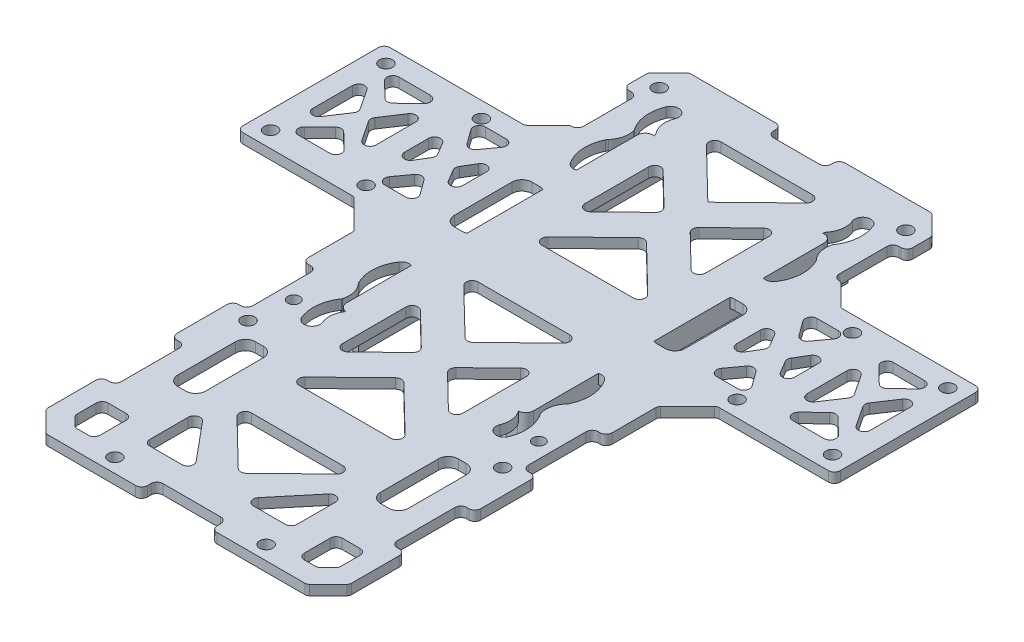
from build123d import *

# Parameters (mm, degrees)
Y_KSEKLIK_EKSTR_ZYON1_DEPTH = 2.5
IZIM3_R                     = 1.65
KES_EKSTR_ZYON1_DEPTH       = 173.688537138
IZIM4_W                     = 5
IZIM4_H                     = 77
Y_KSEKLIK_EKSTR_ZYON2_DEPTH = 2.7
IZIM5_W                     = 9
IZIM5_H                     = 2.5
Y_KSEKLIK_EKSTR_ZYON3_DEPTH = 77
Y_KSEKLIK_EKSTR_ZYON4_DEPTH = 2.5
RADYUS1_R                   = 2
Y_KSEKLIK_EKSTR_ZYON5_DEPTH = 2.5
IZIM8_R                     = 1.5
KES_EKSTR_ZYON2_DEPTH       = 173.748721728


with BuildPart() as part:
    # Çizim1 → Yükseklik-Ekstrüzyon1 (new body)
    with BuildSketch(Plane(origin=(0, 0, 0), x_dir=(1, 0, 0), z_dir=(0, 1, 0))):
        with BuildLine():
            Line((5.75, 152), (-5.75, 152))
            ThreePointArc((-5.75, 152), (-6.810660172, 152.439339828), (-7.25, 153.5))
            Line((-7.25, 153.5), (-7.25, 154))
            ThreePointArc((-7.25, 154), (-7.689339828, 155.060660172), (-8.75, 155.5))
            Line((-8.75, 155.5), (-30.05, 155.5))
            ThreePointArc((-30.05, 155.5), (-30.497739616, 155.410939053), (-30.877314934, 155.157314934))
            Line((-30.877314934, 155.157314934), (-35.296732316, 150.737897552))
            ThreePointArc((-35.296732316, 150.737897552), (-35.550356435, 150.358322233), (-35.639417382, 149.910582618))
            Line((-35.639417382, 149.910582618), (-35.639417382, 145.610582618))
            ThreePointArc((-35.639417382, 145.610582618), (-35.200077554, 144.549922446), (-34.139417382, 144.110582618))
            Line((-34.139417382, 144.110582618), (-33.639417382, 144.110582618))
            ThreePointArc((-33.639417382, 144.110582618), (-32.578757211, 143.671242789), (-32.139417382, 142.610582618))
            Line((-32.139417382, 142.610582618), (-32.139417382, 130.610582618))
            ThreePointArc((-32.139417382, 130.610582618), (-32.578757211, 129.549922446), (-33.639417382, 129.110582618))
            ThreePointArc((-33.639417382, 129.110582618), (-34.060369158, 129.026850103), (-34.417234842, 128.788400077))
            Line((-34.417234842, 128.788400077), (-39.437692988, 123.76794193))
            ThreePointArc((-39.437692988, 123.76794193), (-39.794558672, 123.529491904), (-40.215510447, 123.44575939))
            Line((-40.215510447, 123.44575939), (-73.565510447, 123.44575939))
            ThreePointArc((-73.565510447, 123.44575939), (-74.626170619, 123.006419562), (-75.065510447, 121.94575939))
            Line((-75.065510447, 121.94575939), (-75.065510447, 87.94575939))
            ThreePointArc((-75.065510447, 87.94575939), (-74.626170619, 86.885099218), (-73.565510447, 86.44575939))
            Line((-73.565510447, 86.44575939), (-46.115510447, 86.44575939))
            ThreePointArc((-46.115510447, 86.44575939), (-45.667770832, 86.356698443), (-45.288195513, 86.103074324))
            Line((-45.288195513, 86.103074324), (-38.499970414, 79.314849224))
            ThreePointArc((-38.499970414, 79.314849224), (-38.246346295, 78.935273906), (-38.157285348, 78.48753429))
            Line((-38.157285348, 78.48753429), (-38.157285348, 67.48753429))
            ThreePointArc((-38.157285348, 67.48753429), (-37.71794552, 66.426874119), (-36.657285348, 65.98753429))
            Line((-36.657285348, 65.98753429), (-36.157285348, 65.98753429))
            ThreePointArc((-36.157285348, 65.98753429), (-35.096625176, 65.548194462), (-34.657285348, 64.48753429))
            Line((-34.657285348, 64.48753429), (-34.657285348, 49.98753429))
            ThreePointArc((-34.657285348, 49.98753429), (-35.096625176, 48.926874119), (-36.157285348, 48.48753429))
            Line((-36.157285348, 48.48753429), (-36.657285348, 48.48753429))
            ThreePointArc((-36.657285348, 48.48753429), (-37.71794552, 48.048194462), (-38.157285348, 46.98753429))
            Line((-38.157285348, 46.98753429), (-38.157285348, 34.48753429))
            ThreePointArc((-38.157285348, 34.48753429), (-37.71794552, 33.426874119), (-36.657285348, 32.98753429))
            Line((-36.657285348, 32.98753429), (-36.157285348, 32.98753429))
            ThreePointArc((-36.157285348, 32.98753429), (-35.096625176, 32.548194462), (-34.657285348, 31.48753429))
            Line((-34.657285348, 31.48753429), (-34.657285348, 16.98753429))
            ThreePointArc((-34.657285348, 16.98753429), (-35.096625176, 15.926874119), (-36.157285348, 15.48753429))
            Line((-36.157285348, 15.48753429), (-36.657285348, 15.48753429))
            ThreePointArc((-36.657285348, 15.48753429), (-37.71794552, 15.048194462), (-38.157285348, 13.98753429))
            Line((-38.157285348, 13.98753429), (-38.157285348, 1.98753429))
            ThreePointArc((-38.157285348, 1.98753429), (-38.073552834, 1.566582515), (-37.835102807, 1.209716831))
            Line((-37.835102807, 1.209716831), (-33.097487373, -3.527898603))
            ThreePointArc((-33.097487373, -3.527898603), (-32.74062169, -3.766348629), (-32.319669914, -3.850081144))
            Line((-32.319669914, -3.850081144), (-10.25, -3.850081144))
            ThreePointArc((-10.25, -3.850081144), (-9.189339828, -3.410741315), (-8.75, -2.350081144))
            Line((-8.75, -2.350081144), (-8.75, -1.5))
            ThreePointArc((-8.75, -1.5), (-8.310660172, -0.439339828), (-7.25, 0))
            Line((-7.25, 0), (7.25, 0))
            ThreePointArc((7.25, 0), (8.310660172, -0.439339828), (8.75, -1.5))
            Line((8.75, -1.5), (8.75, -2.350081144))
            ThreePointArc((8.75, -2.350081144), (9.189339828, -3.410741315), (10.25, -3.850081144))
            Line((10.25, -3.850081144), (32.319669914, -3.850081144))
            ThreePointArc((32.319669914, -3.850081144), (32.74062169, -3.766348629), (33.097487373, -3.527898603))
            Line((33.097487373, -3.527898603), (37.835102807, 1.209716831))
            ThreePointArc((37.835102807, 1.209716831), (38.073552834, 1.566582515), (38.157285348, 1.98753429))
            Line((38.157285348, 1.98753429), (38.157285348, 13.98753429))
            ThreePointArc((38.157285348, 13.98753429), (37.71794552, 15.048194462), (36.657285348, 15.48753429))
            Line((36.657285348, 15.48753429), (36.157285348, 15.48753429))
            ThreePointArc((36.157285348, 15.48753429), (35.096625176, 15.926874119), (34.657285348, 16.98753429))
            Line((34.657285348, 16.98753429), (34.657285348, 31.48753429))
            ThreePointArc((34.657285348, 31.48753429), (35.096625176, 32.548194462), (36.157285348, 32.98753429))
            Line((36.157285348, 32.98753429), (36.657285348, 32.98753429))
            ThreePointArc((36.657285348, 32.98753429), (37.71794552, 33.426874119), (38.157285348, 34.48753429))
            Line((38.157285348, 34.48753429), (38.157285348, 46.98753429))
            ThreePointArc((38.157285348, 46.98753429), (37.71794552, 48.048194462), (36.657285348, 48.48753429))
            Line((36.657285348, 48.48753429), (36.157285348, 48.48753429))
            ThreePointArc((36.157285348, 48.48753429), (35.096625176, 48.926874119), (34.657285348, 49.98753429))
            Line((34.657285348, 49.98753429), (34.657285348, 64.48753429))
            ThreePointArc((34.657285348, 64.48753429), (35.096625176, 65.548194462), (36.157285348, 65.98753429))
            Line((36.157285348, 65.98753429), (36.657285348, 65.98753429))
            ThreePointArc((36.657285348, 65.98753429), (37.71794552, 66.426874119), (38.157285348, 67.48753429))
            Line((38.157285348, 67.48753429), (38.157285348, 78.48753429))
            ThreePointArc((38.157285348, 78.48753429), (38.246346295, 78.935273906), (38.499970414, 79.314849224))
            Line((38.499970414, 79.314849224), (45.288195513, 86.103074324))
            ThreePointArc((45.288195513, 86.103074324), (45.667770832, 86.356698443), (46.115510447, 86.44575939))
            Line((46.115510447, 86.44575939), (73.565510447, 86.44575939))
            ThreePointArc((73.565510447, 86.44575939), (74.626170619, 86.885099218), (75.065510447, 87.94575939))
            Line((75.065510447, 87.94575939), (75.065510447, 121.94575939))
            ThreePointArc((75.065510447, 121.94575939), (74.626170619, 123.006419562), (73.565510447, 123.44575939))
            Line((73.565510447, 123.44575939), (40.215510447, 123.44575939))
            ThreePointArc((40.215510447, 123.44575939), (39.794558672, 123.529491904), (39.437692988, 123.76794193))
            Line((39.437692988, 123.76794193), (34.417234842, 128.788400077))
            ThreePointArc((34.417234842, 128.788400077), (34.060369158, 129.026850103), (33.639417382, 129.110582618))
            ThreePointArc((33.639417382, 129.110582618), (32.578757211, 129.549922446), (32.139417382, 130.610582618))
            Line((32.139417382, 130.610582618), (32.139417382, 142.610582618))
            ThreePointArc((32.139417382, 142.610582618), (32.578757211, 143.671242789), (33.639417382, 144.110582618))
            Line((33.639417382, 144.110582618), (34.139417382, 144.110582618))
            ThreePointArc((34.139417382, 144.110582618), (35.200077554, 144.549922446), (35.639417382, 145.610582618))
            Line((35.639417382, 145.610582618), (35.639417382, 149.910582618))
            ThreePointArc((35.639417382, 149.910582618), (35.550356435, 150.358322233), (35.296732316, 150.737897552))
            Line((35.296732316, 150.737897552), (30.877314934, 155.157314934))
            ThreePointArc((30.877314934, 155.157314934), (30.497739616, 155.410939053), (30.05, 155.5))
            Line((30.05, 155.5), (8.75, 155.5))
            ThreePointArc((8.75, 155.5), (7.689339828, 155.060660172), (7.25, 154))
            Line((7.25, 154), (7.25, 153.5))
            ThreePointArc((7.25, 153.5), (6.810660172, 152.439339828), (5.75, 152))
        make_face()
        with BuildLine():
            Line((-25.657285348, 9.149918856), (-25.657285348, 2.649918856))
            ThreePointArc((-25.657285348, 2.649918856), (-26.096625176, 1.589258685), (-27.157285348, 1.149918856))
            Line((-27.157285348, 1.149918856), (-29.889518395, 1.149918856))
            ThreePointArc((-29.889518395, 1.149918856), (-30.463543544, 1.264099558), (-30.950178567, 1.589258685))
            Line((-30.950178567, 1.589258685), (-32.71794552, 3.357025638))
            ThreePointArc((-32.71794552, 3.357025638), (-33.043104647, 3.843660661), (-33.157285348, 4.417685809))
            Line((-33.157285348, 4.417685809), (-33.157285348, 9.149918856))
            ThreePointArc((-33.157285348, 9.149918856), (-32.71794552, 10.210579028), (-31.657285348, 10.649918856))
            Line((-31.657285348, 10.649918856), (-27.157285348, 10.649918856))
            ThreePointArc((-27.157285348, 10.649918856), (-26.096625176, 10.210579028), (-25.657285348, 9.149918856))
        make_face(mode=Mode.SUBTRACT)
        with BuildLine():
            Line((-9, 6.5), (-17, 6.5))
            ThreePointArc((-17, 6.5), (-18.060660172, 6.939339828), (-18.5, 8))
            Line((-18.5, 8), (-18.5, 17.604686356))
            ThreePointArc((-18.5, 17.604686356), (-17.510468636, 19.015154992), (-15.847437637, 18.564686356))
            Line((-15.847437637, 18.564686356), (-7.847437637, 8.96))
            ThreePointArc((-7.847437637, 8.96), (-7.641692229, 7.363603897), (-9, 6.5))
        make_face(mode=Mode.SUBTRACT)
        with BuildLine():
            Line((-22, 40), (-22, 25.5))
            ThreePointArc((-22, 25.5), (-22.732233047, 23.732233047), (-24.5, 23))
            Line((-24.5, 23), (-26.5, 23))
            ThreePointArc((-26.5, 23), (-28.267766953, 23.732233047), (-29, 25.5))
            Line((-29, 25.5), (-29, 40))
            ThreePointArc((-29, 40), (-28.267766953, 41.767766953), (-26.5, 42.5))
            Line((-26.5, 42.5), (-24.5, 42.5))
            ThreePointArc((-24.5, 42.5), (-22.732233047, 41.767766953), (-22, 40))
        make_face(mode=Mode.SUBTRACT)
        with BuildLine():
            ThreePointArc((-26.434281569, 68.442247904), (-27.387542064, 73.266531171), (-25.800948235, 77.921113284))
            ThreePointArc((-25.800948235, 77.921113284), (-23.026172025, 78.46939878), (-22.47788653, 75.69462257))
            ThreePointArc((-22.47788653, 75.69462257), (-23.387146727, 73.119372687), (-22.945594409, 70.4242479))
            ThreePointArc((-22.945594409, 70.4242479), (-20.870743148, 66.017638876), (-21.252362598, 61.16196411))
            ThreePointArc((-21.252362598, 61.16196411), (-21.381863297, 60.870088049), (-21.556164957, 60.602541796))
            ThreePointArc((-21.556164957, 60.602541796), (-22.653112662, 57.975343896), (-22.28949829, 55.151649922))
            ThreePointArc((-22.28949829, 55.151649922), (-23.37928624, 52.541599688), (-25.989336474, 53.631387637))
            ThreePointArc((-25.989336474, 53.631387637), (-26.640066338, 58.326939766), (-24.940834447, 62.752351626))
            ThreePointArc((-24.940834447, 62.752351626), (-24.85173844, 65.524195112), (-26.126472167, 67.987142196))
            ThreePointArc((-26.126472167, 67.987142196), (-26.296079187, 68.204074833), (-26.434281569, 68.442247904))
        make_face(mode=Mode.SUBTRACT)
        with BuildLine():
            ThreePointArc((-15.139417382, 69), (-14.223093525, 70.381782241), (-12.593654502, 70.075351104))
            Line((-12.593654502, 70.075351104), (-4.367307028, 62.075351104))
            ThreePointArc((-4.367307028, 62.075351104), (-3.913069909, 61), (-4.367307028, 59.924648896))
            Line((-4.367307028, 59.924648896), (-12.593654502, 51.924648896))
            ThreePointArc((-12.593654502, 51.924648896), (-14.223093525, 51.618217759), (-15.139417382, 53))
            Line((-15.139417382, 53), (-15.139417382, 69))
        make_face(mode=Mode.SUBTRACT)
        with BuildLine():
            ThreePointArc((9, 6.5), (7.641692229, 7.363603897), (7.847437637, 8.96))
            Line((7.847437637, 8.96), (15.847437637, 18.564686356))
            ThreePointArc((15.847437637, 18.564686356), (17.510468636, 19.015154992), (18.5, 17.604686356))
            Line((18.5, 17.604686356), (18.5, 8))
            ThreePointArc((18.5, 8), (18.060660172, 6.939339828), (17, 6.5))
            Line((17, 6.5), (9, 6.5))
        make_face(mode=Mode.SUBTRACT)
        with BuildLine():
            ThreePointArc((25.657285348, 9.149918856), (26.096625176, 10.210579028), (27.157285348, 10.649918856))
            Line((27.157285348, 10.649918856), (31.657285348, 10.649918856))
            ThreePointArc((31.657285348, 10.649918856), (32.71794552, 10.210579028), (33.157285348, 9.149918856))
            Line((33.157285348, 9.149918856), (33.157285348, 4.417685809))
            ThreePointArc((33.157285348, 4.417685809), (33.043104647, 3.843660661), (32.71794552, 3.357025638))
            Line((32.71794552, 3.357025638), (30.950178567, 1.589258685))
            ThreePointArc((30.950178567, 1.589258685), (30.463543544, 1.264099558), (29.889518395, 1.149918856))
            Line((29.889518395, 1.149918856), (27.157285348, 1.149918856))
            ThreePointArc((27.157285348, 1.149918856), (26.096625176, 1.589258685), (25.657285348, 2.649918856))
            Line((25.657285348, 2.649918856), (25.657285348, 9.149918856))
        make_face(mode=Mode.SUBTRACT)
        with BuildLine():
            ThreePointArc((11.5, 26.5), (12.889788951, 25.564346234), (12.545762881, 23.924648896))
            Line((12.545762881, 23.924648896), (1.045762881, 12.741070729))
            ThreePointArc((1.045762881, 12.741070729), (0, 12.316421833), (-1.045762881, 12.741070729))
            Line((-1.045762881, 12.741070729), (-12.545762881, 23.924648896))
            ThreePointArc((-12.545762881, 23.924648896), (-12.889788951, 25.564346234), (-11.5, 26.5))
            Line((-11.5, 26.5), (11.5, 26.5))
        make_face(mode=Mode.SUBTRACT)
        with BuildLine():
            ThreePointArc((22, 40), (22.732233047, 41.767766953), (24.5, 42.5))
            Line((24.5, 42.5), (26.5, 42.5))
            ThreePointArc((26.5, 42.5), (28.267766953, 41.767766953), (29, 40))
            Line((29, 40), (29, 25.5))
            ThreePointArc((29, 25.5), (28.267766953, 23.732233047), (26.5, 23))
            Line((26.5, 23), (24.5, 23))
            ThreePointArc((24.5, 23), (22.732233047, 23.732233047), (22, 25.5))
            Line((22, 25.5), (22, 40))
        make_face(mode=Mode.SUBTRACT)
        with BuildLine():
            Line((11.5, 38.5), (-11.5, 38.5))
            ThreePointArc((-11.5, 38.5), (-12.889788951, 39.435653766), (-12.545762881, 41.075351104))
            Line((-12.545762881, 41.075351104), (-1.045762881, 52.258929271))
            ThreePointArc((-1.045762881, 52.258929271), (0, 52.683578167), (1.045762881, 52.258929271))
            Line((1.045762881, 52.258929271), (12.545762881, 41.075351104))
            ThreePointArc((12.545762881, 41.075351104), (12.889788951, 39.435653766), (11.5, 38.5))
        make_face(mode=Mode.SUBTRACT)
        with BuildLine():
            Line((15.139417382, 69), (15.139417382, 53))
            ThreePointArc((15.139417382, 53), (14.223093525, 51.618217759), (12.593654502, 51.924648896))
            Line((12.593654502, 51.924648896), (4.367307028, 59.924648896))
            ThreePointArc((4.367307028, 59.924648896), (3.913069909, 61), (4.367307028, 62.075351104))
            Line((4.367307028, 62.075351104), (12.593654502, 70.075351104))
            ThreePointArc((12.593654502, 70.075351104), (14.223093525, 70.381782241), (15.139417382, 69))
        make_face(mode=Mode.SUBTRACT)
        with BuildLine():
            ThreePointArc((21.556164957, 60.602541796), (21.381863297, 60.870088049), (21.252362598, 61.16196411))
            ThreePointArc((21.252362598, 61.16196411), (20.870743148, 66.017638876), (22.945594409, 70.4242479))
            ThreePointArc((22.945594409, 70.4242479), (23.387146727, 73.119372687), (22.47788653, 75.69462257))
            ThreePointArc((22.47788653, 75.69462257), (23.026172025, 78.46939878), (25.800948235, 77.921113284))
            ThreePointArc((25.800948235, 77.921113284), (27.387542064, 73.266531171), (26.434281569, 68.442247904))
            ThreePointArc((26.434281569, 68.442247904), (26.296079187, 68.204074833), (26.126472167, 67.987142196))
            ThreePointArc((26.126472167, 67.987142196), (24.85173844, 65.524195112), (24.940834447, 62.752351626))
            ThreePointArc((24.940834447, 62.752351626), (26.640066338, 58.326939766), (25.989336474, 53.631387637))
            ThreePointArc((25.989336474, 53.631387637), (23.37928624, 52.541599688), (22.28949829, 55.151649922))
            ThreePointArc((22.28949829, 55.151649922), (22.653112662, 57.975343896), (21.556164957, 60.602541796))
        make_face(mode=Mode.SUBTRACT)
        with BuildLine():
            ThreePointArc((-70.065510447, 110.508796371), (-68.998523149, 111.944937033), (-67.315510447, 111.337952569))
            Line((-67.315510447, 111.337952569), (-63.998885657, 106.337952569))
            ThreePointArc((-63.998885657, 106.337952569), (-63.748885657, 105.508796371), (-63.998885657, 104.679640173))
            Line((-63.998885657, 104.679640173), (-67.315510447, 99.679640173))
            ThreePointArc((-67.315510447, 99.679640173), (-68.998523149, 99.072655709), (-70.065510447, 100.508796371))
            Line((-70.065510447, 100.508796371), (-70.065510447, 110.508796371))
        make_face(mode=Mode.SUBTRACT)
        with BuildLine():
            ThreePointArc((-63.159293697, 99.276311326), (-62.115510447, 99.699038599), (-61.071727198, 99.276311326))
            Line((-61.071727198, 99.276311326), (-57.121727198, 95.449106079))
            ThreePointArc((-57.121727198, 95.449106079), (-56.775203091, 93.808765457), (-58.165510447, 92.871833352))
            Line((-58.165510447, 92.871833352), (-66.065510447, 92.871833352))
            ThreePointArc((-66.065510447, 92.871833352), (-67.455817804, 93.808765457), (-67.109293697, 95.449106079))
            Line((-67.109293697, 95.449106079), (-63.159293697, 99.276311326))
        make_face(mode=Mode.SUBTRACT)
        with BuildLine():
            Line((-60.232135238, 106.337952569), (-56.915510447, 111.337952569))
            ThreePointArc((-56.915510447, 111.337952569), (-55.232497746, 111.944937033), (-54.165510447, 110.508796371))
            Line((-54.165510447, 110.508796371), (-54.165510447, 100.508796371))
            ThreePointArc((-54.165510447, 100.508796371), (-55.232497746, 99.072655709), (-56.915510447, 99.679640173))
            Line((-56.915510447, 99.679640173), (-60.232135238, 104.679640173))
            ThreePointArc((-60.232135238, 104.679640173), (-60.482135238, 105.508796371), (-60.232135238, 106.337952569))
        make_face(mode=Mode.SUBTRACT)
        with BuildLine():
            Line((-57.121727198, 115.568486662), (-61.071727198, 111.741281416))
            ThreePointArc((-61.071727198, 111.741281416), (-62.115510447, 111.318554143), (-63.159293697, 111.741281416))
            Line((-63.159293697, 111.741281416), (-67.109293697, 115.568486662))
            ThreePointArc((-67.109293697, 115.568486662), (-67.455817804, 117.208827285), (-66.065510447, 118.14575939))
            Line((-66.065510447, 118.14575939), (-58.165510447, 118.14575939))
            ThreePointArc((-58.165510447, 118.14575939), (-56.775203091, 117.208827285), (-57.121727198, 115.568486662))
        make_face(mode=Mode.SUBTRACT)
        with BuildLine():
            Line((-39.065510447, 92.871833352), (-44.365510447, 92.871833352))
            ThreePointArc((-44.365510447, 92.871833352), (-45.702484643, 93.691759827), (-45.577831454, 95.255166686))
            Line((-45.577831454, 95.255166686), (-42.927831454, 98.892129704))
            ThreePointArc((-42.927831454, 98.892129704), (-41.715510447, 99.508796371), (-40.503189441, 98.892129704))
            Line((-40.503189441, 98.892129704), (-37.853189441, 95.255166686))
            ThreePointArc((-37.853189441, 95.255166686), (-37.728536252, 93.691759827), (-39.065510447, 92.871833352))
        make_face(mode=Mode.SUBTRACT)
        with BuildLine():
            ThreePointArc((-49, 108.508796371), (-47.900891863, 109.954232538), (-46.214285714, 109.281414501))
            Line((-46.214285714, 109.281414501), (-44.411510077, 106.281414501))
            ThreePointArc((-44.411510077, 106.281414501), (-44.197224362, 105.508796371), (-44.411510077, 104.736178241))
            Line((-44.411510077, 104.736178241), (-46.214285714, 101.736178241))
            ThreePointArc((-46.214285714, 101.736178241), (-47.900891863, 101.063360203), (-49, 102.508796371))
            Line((-49, 102.508796371), (-49, 108.508796371))
        make_face(mode=Mode.SUBTRACT)
        with BuildLine():
            ThreePointArc((-45.577831454, 115.762426056), (-45.702484643, 117.325832915), (-44.365510447, 118.14575939))
            Line((-44.365510447, 118.14575939), (-39.065510447, 118.14575939))
            ThreePointArc((-39.065510447, 118.14575939), (-37.728536252, 117.325832915), (-37.853189441, 115.762426056))
            Line((-37.853189441, 115.762426056), (-40.503189441, 112.125463038))
            ThreePointArc((-40.503189441, 112.125463038), (-41.715510447, 111.508796371), (-42.927831454, 112.125463038))
            Line((-42.927831454, 112.125463038), (-45.577831454, 115.762426056))
        make_face(mode=Mode.SUBTRACT)
        with BuildLine():
            Line((-39.019510818, 106.281414501), (-37.216735181, 109.281414501))
            ThreePointArc((-37.216735181, 109.281414501), (-35.530129032, 109.954232538), (-34.431020895, 108.508796371))
            Line((-34.431020895, 108.508796371), (-34.431020895, 102.508796371))
            ThreePointArc((-34.431020895, 102.508796371), (-35.530129032, 101.063360203), (-37.216735181, 101.736178241))
            Line((-37.216735181, 101.736178241), (-39.019510818, 104.736178241))
            ThreePointArc((-39.019510818, 104.736178241), (-39.233796533, 105.508796371), (-39.019510818, 106.281414501))
        make_face(mode=Mode.SUBTRACT)
        with BuildLine():
            Line((-29, 95), (-29, 109.5))
            ThreePointArc((-29, 109.5), (-28.267766953, 111.267766953), (-26.5, 112))
            Line((-26.5, 112), (-24.5, 112))
            ThreePointArc((-24.5, 112), (-22.732233047, 111.267766953), (-22, 109.5))
            Line((-22, 109.5), (-22, 95))
            ThreePointArc((-22, 95), (-22.732233047, 93.232233047), (-24.5, 92.5))
            Line((-24.5, 92.5), (-26.5, 92.5))
            ThreePointArc((-26.5, 92.5), (-28.267766953, 93.232233047), (-29, 95))
        make_face(mode=Mode.SUBTRACT)
        with BuildLine():
            ThreePointArc((-22.47788653, 123.19689621), (-23.026172025, 120.42212), (-25.800948235, 120.970405496))
            ThreePointArc((-25.800948235, 120.970405496), (-27.387542064, 125.624987608), (-26.434281569, 130.449270876))
            ThreePointArc((-26.434281569, 130.449270876), (-26.296079187, 130.687443947), (-26.126472167, 130.904376583))
            ThreePointArc((-26.126472167, 130.904376583), (-24.85173844, 133.367323667), (-24.940834447, 136.139167154))
            ThreePointArc((-24.940834447, 136.139167154), (-26.640066338, 140.564579014), (-25.989336474, 145.260131142))
            ThreePointArc((-25.989336474, 145.260131142), (-23.37928624, 146.349919092), (-22.28949829, 143.739868858))
            ThreePointArc((-22.28949829, 143.739868858), (-22.653112662, 140.916174884), (-21.556164957, 138.288976984))
            ThreePointArc((-21.556164957, 138.288976984), (-21.381863297, 138.021430731), (-21.252362598, 137.729554669))
            ThreePointArc((-21.252362598, 137.729554669), (-20.870743148, 132.873879903), (-22.945594409, 128.46727088))
            ThreePointArc((-22.945594409, 128.46727088), (-23.387146727, 125.772146093), (-22.47788653, 123.19689621))
        make_face(mode=Mode.SUBTRACT)
        with BuildLine():
            Line((-4.367307028, 120.924648896), (-12.593654502, 112.924648896))
            ThreePointArc((-12.593654502, 112.924648896), (-14.223093525, 112.618217759), (-15.139417382, 114))
            Line((-15.139417382, 114), (-15.139417382, 130))
            ThreePointArc((-15.139417382, 130), (-14.223093525, 131.381782241), (-12.593654502, 131.075351104))
            Line((-12.593654502, 131.075351104), (-4.367307028, 123.075351104))
            ThreePointArc((-4.367307028, 123.075351104), (-3.913069909, 122), (-4.367307028, 120.924648896))
        make_face(mode=Mode.SUBTRACT)
        with BuildLine():
            ThreePointArc((11.5, 83.5), (12.889788951, 82.564346234), (12.545762881, 80.924648896))
            Line((12.545762881, 80.924648896), (1.045762881, 69.741070729))
            ThreePointArc((1.045762881, 69.741070729), (0, 69.316421833), (-1.045762881, 69.741070729))
            Line((-1.045762881, 69.741070729), (-12.545762881, 80.924648896))
            ThreePointArc((-12.545762881, 80.924648896), (-12.889788951, 82.564346234), (-11.5, 83.5))
            Line((-11.5, 83.5), (11.5, 83.5))
        make_face(mode=Mode.SUBTRACT)
        with BuildLine():
            Line((11.5, 99.5), (-11.5, 99.5))
            ThreePointArc((-11.5, 99.5), (-12.889788951, 100.435653766), (-12.545762881, 102.075351104))
            Line((-12.545762881, 102.075351104), (-1.045762881, 113.258929271))
            ThreePointArc((-1.045762881, 113.258929271), (0, 113.683578167), (1.045762881, 113.258929271))
            Line((1.045762881, 113.258929271), (12.545762881, 102.075351104))
            ThreePointArc((12.545762881, 102.075351104), (12.889788951, 100.435653766), (11.5, 99.5))
        make_face(mode=Mode.SUBTRACT)
        with BuildLine():
            ThreePointArc((22, 109.5), (22.732233047, 111.267766953), (24.5, 112))
            Line((24.5, 112), (26.5, 112))
            ThreePointArc((26.5, 112), (28.267766953, 111.267766953), (29, 109.5))
            Line((29, 109.5), (29, 95))
            ThreePointArc((29, 95), (28.267766953, 93.232233047), (26.5, 92.5))
            Line((26.5, 92.5), (24.5, 92.5))
            ThreePointArc((24.5, 92.5), (22.732233047, 93.232233047), (22, 95))
            Line((22, 95), (22, 109.5))
        make_face(mode=Mode.SUBTRACT)
        with BuildLine():
            ThreePointArc((37.216735181, 101.736178241), (35.530129032, 101.063360203), (34.431020895, 102.508796371))
            Line((34.431020895, 102.508796371), (34.431020895, 108.508796371))
            ThreePointArc((34.431020895, 108.508796371), (35.530129032, 109.954232538), (37.216735181, 109.281414501))
            Line((37.216735181, 109.281414501), (39.019510818, 106.281414501))
            ThreePointArc((39.019510818, 106.281414501), (39.233796533, 105.508796371), (39.019510818, 104.736178241))
            Line((39.019510818, 104.736178241), (37.216735181, 101.736178241))
        make_face(mode=Mode.SUBTRACT)
        with BuildLine():
            ThreePointArc((40.503189441, 98.892129704), (41.715510447, 99.508796371), (42.927831454, 98.892129704))
            Line((42.927831454, 98.892129704), (45.577831454, 95.255166686))
            ThreePointArc((45.577831454, 95.255166686), (45.702484643, 93.691759827), (44.365510447, 92.871833352))
            Line((44.365510447, 92.871833352), (39.065510447, 92.871833352))
            ThreePointArc((39.065510447, 92.871833352), (37.728536252, 93.691759827), (37.853189441, 95.255166686))
            Line((37.853189441, 95.255166686), (40.503189441, 98.892129704))
        make_face(mode=Mode.SUBTRACT)
        with BuildLine():
            Line((46.214285714, 101.736178241), (44.411510077, 104.736178241))
            ThreePointArc((44.411510077, 104.736178241), (44.197224362, 105.508796371), (44.411510077, 106.281414501))
            Line((44.411510077, 106.281414501), (46.214285714, 109.281414501))
            ThreePointArc((46.214285714, 109.281414501), (47.900891863, 109.954232538), (49, 108.508796371))
            Line((49, 108.508796371), (49, 102.508796371))
            ThreePointArc((49, 102.508796371), (47.900891863, 101.063360203), (46.214285714, 101.736178241))
        make_face(mode=Mode.SUBTRACT)
        with BuildLine():
            Line((40.503189441, 112.125463038), (37.853189441, 115.762426056))
            ThreePointArc((37.853189441, 115.762426056), (37.728536252, 117.325832915), (39.065510447, 118.14575939))
            Line((39.065510447, 118.14575939), (44.365510447, 118.14575939))
            ThreePointArc((44.365510447, 118.14575939), (45.702484643, 117.325832915), (45.577831454, 115.762426056))
            Line((45.577831454, 115.762426056), (42.927831454, 112.125463038))
            ThreePointArc((42.927831454, 112.125463038), (41.715510447, 111.508796371), (40.503189441, 112.125463038))
        make_face(mode=Mode.SUBTRACT)
        with BuildLine():
            Line((63.159293697, 99.276311326), (67.109293697, 95.449106079))
            ThreePointArc((67.109293697, 95.449106079), (67.455817804, 93.808765457), (66.065510447, 92.871833352))
            Line((66.065510447, 92.871833352), (58.165510447, 92.871833352))
            ThreePointArc((58.165510447, 92.871833352), (56.775203091, 93.808765457), (57.121727198, 95.449106079))
            Line((57.121727198, 95.449106079), (61.071727198, 99.276311326))
            ThreePointArc((61.071727198, 99.276311326), (62.115510447, 99.699038599), (63.159293697, 99.276311326))
        make_face(mode=Mode.SUBTRACT)
        with BuildLine():
            ThreePointArc((56.915510447, 99.679640173), (55.232497746, 99.072655709), (54.165510447, 100.508796371))
            Line((54.165510447, 100.508796371), (54.165510447, 110.508796371))
            ThreePointArc((54.165510447, 110.508796371), (55.232497746, 111.944937033), (56.915510447, 111.337952569))
            Line((56.915510447, 111.337952569), (60.232135238, 106.337952569))
            ThreePointArc((60.232135238, 106.337952569), (60.482135238, 105.508796371), (60.232135238, 104.679640173))
            Line((60.232135238, 104.679640173), (56.915510447, 99.679640173))
        make_face(mode=Mode.SUBTRACT)
        with BuildLine():
            Line((67.315510447, 99.679640173), (63.998885657, 104.679640173))
            ThreePointArc((63.998885657, 104.679640173), (63.748885657, 105.508796371), (63.998885657, 106.337952569))
            Line((63.998885657, 106.337952569), (67.315510447, 111.337952569))
            ThreePointArc((67.315510447, 111.337952569), (68.998523149, 111.944937033), (70.065510447, 110.508796371))
            Line((70.065510447, 110.508796371), (70.065510447, 100.508796371))
            ThreePointArc((70.065510447, 100.508796371), (68.998523149, 99.072655709), (67.315510447, 99.679640173))
        make_face(mode=Mode.SUBTRACT)
        with BuildLine():
            ThreePointArc((57.121727198, 115.568486662), (56.775203091, 117.208827285), (58.165510447, 118.14575939))
            Line((58.165510447, 118.14575939), (66.065510447, 118.14575939))
            ThreePointArc((66.065510447, 118.14575939), (67.455817804, 117.208827285), (67.109293697, 115.568486662))
            Line((67.109293697, 115.568486662), (63.159293697, 111.741281416))
            ThreePointArc((63.159293697, 111.741281416), (62.115510447, 111.318554143), (61.071727198, 111.741281416))
            Line((61.071727198, 111.741281416), (57.121727198, 115.568486662))
        make_face(mode=Mode.SUBTRACT)
        with BuildLine():
            ThreePointArc((4.367307028, 120.924648896), (3.913069909, 122), (4.367307028, 123.075351104))
            Line((4.367307028, 123.075351104), (12.593654502, 131.075351104))
            ThreePointArc((12.593654502, 131.075351104), (14.223093525, 131.381782241), (15.139417382, 130))
            Line((15.139417382, 130), (15.139417382, 114))
            ThreePointArc((15.139417382, 114), (14.223093525, 112.618217759), (12.593654502, 112.924648896))
            Line((12.593654502, 112.924648896), (4.367307028, 120.924648896))
        make_face(mode=Mode.SUBTRACT)
        with BuildLine():
            ThreePointArc((25.989336474, 145.260131142), (26.640066338, 140.564579014), (24.940834447, 136.139167154))
            ThreePointArc((24.940834447, 136.139167154), (24.85173844, 133.367323667), (26.126472167, 130.904376583))
            ThreePointArc((26.126472167, 130.904376583), (26.296079187, 130.687443947), (26.434281569, 130.449270876))
            ThreePointArc((26.434281569, 130.449270876), (27.387542064, 125.624987608), (25.800948235, 120.970405496))
            ThreePointArc((25.800948235, 120.970405496), (23.026172025, 120.42212), (22.47788653, 123.19689621))
            ThreePointArc((22.47788653, 123.19689621), (23.387146727, 125.772146093), (22.945594409, 128.46727088))
            ThreePointArc((22.945594409, 128.46727088), (20.870743148, 132.873879903), (21.252362598, 137.729554669))
            ThreePointArc((21.252362598, 137.729554669), (21.381863297, 138.021430731), (21.556164957, 138.288976984))
            ThreePointArc((21.556164957, 138.288976984), (22.653112662, 140.916174884), (22.28949829, 143.739868858))
            ThreePointArc((22.28949829, 143.739868858), (23.37928624, 146.349919092), (25.989336474, 145.260131142))
        make_face(mode=Mode.SUBTRACT)
        with BuildLine():
            ThreePointArc((-12.545762881, 141.924648896), (-12.889788951, 143.564346234), (-11.5, 144.5))
            Line((-11.5, 144.5), (11.5, 144.5))
            ThreePointArc((11.5, 144.5), (12.889788951, 143.564346234), (12.545762881, 141.924648896))
            Line((12.545762881, 141.924648896), (0, 129.724081953))
            Line((0, 129.724081953), (-12.545762881, 141.924648896))
        make_face(mode=Mode.SUBTRACT)
    extrude(amount=Y_KSEKLIK_EKSTR_ZYON1_DEPTH)

    # Çizim3 → Kes-Ekstrüzyon1 (cut, through all)
    with BuildSketch(Plane.XZ):
        with Locations(Location((-31, -148.5, 0), (0, 0, 270))):
            Circle(IZIM3_R)
        with Locations(Location((-19, 0.300081144, 0), (0, 0, 270))):
            Circle(IZIM3_R)
        with Locations(Location((-32, -46.149918856, 0), (0, 0, 270))):
            Circle(IZIM3_R)
        with Locations(Location((-70.62, -90.44575939, 0), (0, 0, 270))):
            Circle(IZIM3_R)
        with Locations(Location((-46.62, -90.44575939, 0), (0, 0, 270))):
            Circle(IZIM3_R)
        with Locations(Location((-46.62, -119.44575939, 0), (0, 0, 90))):
            Circle(IZIM3_R)
        with Locations(Location((-70.62, -119.44575939, 0), (0, 0, 90))):
            Circle(IZIM3_R)
        with Locations(Location((70.62, -119.44575939, 0), (0, 0, 270))):
            Circle(IZIM3_R)
        with Locations(Location((46.62, -119.44575939, 0), (0, 0, 270))):
            Circle(IZIM3_R)
        with Locations(Location((46.62, -90.44575939, 0), (0, 0, 90))):
            Circle(IZIM3_R)
        with Locations(Location((70.62, -90.44575939, 0), (0, 0, 90))):
            Circle(IZIM3_R)
        with Locations(Location((32, -46.149918856, 0), (0, 0, 90))):
            Circle(IZIM3_R)
        with Locations(Location((19, 0.300081144, 0), (0, 0, 90))):
            Circle(IZIM3_R)
        with Locations(Location((31, -148.5, 0), (0, 0, 90))):
            Circle(IZIM3_R)
    extrude(amount=-KES_EKSTR_ZYON1_DEPTH, mode=Mode.SUBTRACT)

    # Çizim4 → Yükseklik-Ekstrüzyon2 (add)
    with BuildSketch(Plane.XZ):
        with Locations((21, -98.94575939)):
            Rectangle(IZIM4_W, IZIM4_H)
        with Locations((-21, -98.94575939)):
            Rectangle(IZIM4_W, IZIM4_H)
    extrude(amount=Y_KSEKLIK_EKSTR_ZYON2_DEPTH)

    # Çizim5 → Yükseklik-Ekstrüzyon3 (add)
    with BuildSketch(Plane.XY.offset(-60.44575939)):
        with Locations((23, -3.95)):
            Rectangle(IZIM5_W, IZIM5_H)
        with Locations((-23, -3.95)):
            Rectangle(IZIM5_W, IZIM5_H)
    extrude(amount=-Y_KSEKLIK_EKSTR_ZYON3_DEPTH)

    # Çizim6 → Yükseklik-Ekstrüzyon4 (add)
    with BuildSketch(Plane(origin=(0, 0, 0), x_dir=(1, 0, 0), z_dir=(0, 1, 0))):
        with BuildLine():
            Line((21.672790489, 60.44575939), (23.5, 60.44575939))
            Line((23.5, 60.44575939), (23.5, 78.702899697))
            ThreePointArc((23.5, 78.702899697), (22.245737495, 77.451277972), (22.47788653, 75.69462257))
            ThreePointArc((22.47788653, 75.69462257), (23.387146727, 73.119372687), (22.945594409, 70.4242479))
            ThreePointArc((22.945594409, 70.4242479), (20.870743148, 66.017638876), (21.252362598, 61.16196411))
            ThreePointArc((21.252362598, 61.16196411), (21.381863297, 60.870088049), (21.556164957, 60.602541796))
            ThreePointArc((21.556164957, 60.602541796), (21.615174044, 60.524668564), (21.672790489, 60.44575939))
        make_face()
        with BuildLine():
            ThreePointArc((-22.47788653, 75.69462257), (-22.245737495, 77.451277972), (-23.5, 78.702899697))
            Line((-23.5, 78.702899697), (-23.5, 60.44575939))
            Line((-23.5, 60.44575939), (-21.672790489, 60.44575939))
            ThreePointArc((-21.672790489, 60.44575939), (-21.615174044, 60.524668564), (-21.556164957, 60.602541796))
            ThreePointArc((-21.556164957, 60.602541796), (-21.381863297, 60.870088049), (-21.252362598, 61.16196411))
            ThreePointArc((-21.252362598, 61.16196411), (-20.870743148, 66.017638876), (-22.945594409, 70.4242479))
            ThreePointArc((-22.945594409, 70.4242479), (-23.387146727, 73.119372687), (-22.47788653, 75.69462257))
        make_face()
        with BuildLine():
            ThreePointArc((-23.5, 92.708712153), (-22.408349934, 93.630693606), (-22, 95))
            Line((-22, 95), (-22, 109.5))
            ThreePointArc((-22, 109.5), (-22.408349934, 110.869306394), (-23.5, 111.791287847))
            Line((-23.5, 111.791287847), (-23.5, 92.708712153))
        make_face()
        with BuildLine():
            ThreePointArc((22, 95), (22.408349934, 93.630693606), (23.5, 92.708712153))
            Line((23.5, 92.708712153), (23.5, 111.791287847))
            ThreePointArc((23.5, 111.791287847), (22.408349934, 110.869306394), (22, 109.5))
            Line((22, 109.5), (22, 95))
        make_face()
    extrude(amount=Y_KSEKLIK_EKSTR_ZYON4_DEPTH)

    # Radyus1
    radyus1_edges = [part.edges().sort_by_distance(p)[0] for p in [
        (23.5, -1.35, -137.44575939),
        (-23.5, -1.35, -137.44575939),
        (-23.5, -0.1, -60.44575939),
        (23.5, -0.1, -60.44575939),
    ]]
    fillet(radyus1_edges, radius=RADYUS1_R)

    # Çizim7 → Yükseklik-Ekstrüzyon5 (add)
    with BuildSketch(Plane(origin=(0, 0, 0), x_dir=(1, 0, 0), z_dir=(0, 1, 0))):
        with BuildLine():
            Line((-23.5, 135.44575939), (-23.5, 120.188619082))
            ThreePointArc((-23.5, 120.188619082), (-22.245737495, 121.440240808), (-22.47788653, 123.19689621))
            ThreePointArc((-22.47788653, 123.19689621), (-23.387146727, 125.772146093), (-22.945594409, 128.46727088))
            ThreePointArc((-22.945594409, 128.46727088), (-20.898800873, 132.726948045), (-21.157707865, 137.44575939))
            Line((-21.157707865, 137.44575939), (-21.5, 137.44575939))
            ThreePointArc((-21.5, 137.44575939), (-22.914213562, 136.859972952), (-23.5, 135.44575939))
        make_face()
        with BuildLine():
            Line((23.5, 120.188619082), (23.5, 135.44575939))
            ThreePointArc((23.5, 135.44575939), (22.914213562, 136.859972952), (21.5, 137.44575939))
            Line((21.5, 137.44575939), (21.157707865, 137.44575939))
            ThreePointArc((21.157707865, 137.44575939), (20.898800873, 132.726948045), (22.945594409, 128.46727088))
            ThreePointArc((22.945594409, 128.46727088), (23.387146727, 125.772146093), (22.47788653, 123.19689621))
            ThreePointArc((22.47788653, 123.19689621), (22.245737495, 121.440240808), (23.5, 120.188619082))
        make_face()
    extrude(amount=Y_KSEKLIK_EKSTR_ZYON5_DEPTH)

    # Çizim8 → Kes-Ekstrüzyon2 (cut, through all)
    with BuildSketch(Plane.XZ):
        with Locations(Location((-30.8, -56.44575939, 0), (0, 0, 270))):
            Circle(IZIM8_R)
        with Locations(Location((30.8, -56.44575939, 0), (0, 0, 90))):
            Circle(IZIM8_R)
    extrude(amount=-KES_EKSTR_ZYON2_DEPTH, mode=Mode.SUBTRACT)


solid = part.part
